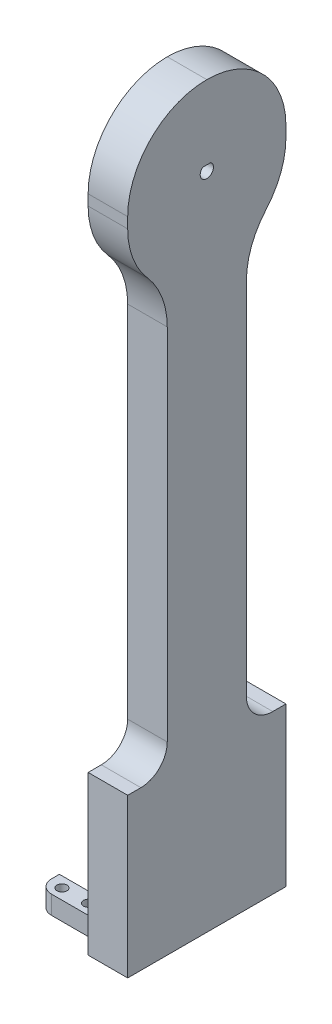
from build123d import *

# Parameters (mm, degrees)
SKETCH1_W           = 60
SKETCH1_H           = 60
BOSS_EXTRUDE1_DEPTH = 15
CUT_EXTRUDE1_DEPTH  = 15
SKETCH8_W           = 15
SKETCH8_H           = 30
BOSS_EXTRUDE2_DEPTH = 160
BOSS_EXTRUDE3_DEPTH = 60
SKETCH10_W          = 8
SKETCH10_H          = 7
BOSS_EXTRUDE4_DEPTH = 20
SKETCH12_R          = 1.9
CUT_EXTRUDE2_DEPTH  = 7
FILLET1_R           = 30
FILLET2_R           = 30
FILLET4_R           = 10
FILLET5_R           = 5


with BuildPart() as part:
    # Sketch1 → Boss-Extrude1 (new body)
    with BuildSketch(Plane(origin=(0, 0, 0), x_dir=(0, 0, -1), z_dir=(1, 0, 0))):
        Rectangle(SKETCH1_W, SKETCH1_H)
    extrude(amount=BOSS_EXTRUDE1_DEPTH)

    # Sketch2 → Cut-Extrude1 (cut)
    with BuildSketch(Plane(origin=(15, 0, 0), x_dir=(0, 0, -1), z_dir=(1, 0, 0))):
        with BuildLine():
            ThreePointArc((2.5, 0), (2.236067977, 1.118033989), (1.5, 2))
            Line((1.5, 2), (-1.5, 2))
            ThreePointArc((-1.5, 2), (-1.118033989, -2.236067977), (2.5, 0))
        make_face()
    extrude(amount=-CUT_EXTRUDE1_DEPTH, mode=Mode.SUBTRACT)

    # Sketch8 → Boss-Extrude2 (add)
    with BuildSketch(Plane.XZ.offset(30)):
        with Locations((7.5, 0)):
            Rectangle(SKETCH8_W, SKETCH8_H)
    extrude(amount=BOSS_EXTRUDE2_DEPTH)

    # Sketch9 → Boss-Extrude3 (add)
    with BuildSketch(Plane.XZ.offset(190)):
        Polygon((0, 0), (0, 30), (15, 30), (15, -30), (0, -30), align=None)
    extrude(amount=BOSS_EXTRUDE3_DEPTH)

    # Sketch10 → Boss-Extrude4 (add)
    with BuildSketch(Plane.ZY):
        with Locations((24.89, -241.5)):
            Rectangle(SKETCH10_W, SKETCH10_H)
        with Locations((-24.89, -241.5)):
            Rectangle(SKETCH10_W, SKETCH10_H)
    extrude(amount=BOSS_EXTRUDE4_DEPTH)

    # Sketch12 → Cut-Extrude2 (cut)
    with BuildSketch(Plane.XZ.offset(245)):
        with Locations(Location((-15.025, 24.89, 0), (0, 0, 270))):
            Circle(SKETCH12_R)
        with Locations(Location((-4.975, 24.89, 0), (0, 0, 270))):
            Circle(SKETCH12_R)
        with Locations(Location((-4.975, -24.89, 0), (0, 0, 270))):
            Circle(SKETCH12_R)
        with Locations(Location((-15.025, -24.89, 0), (0, 0, 270))):
            Circle(SKETCH12_R)
    extrude(amount=-CUT_EXTRUDE2_DEPTH, mode=Mode.SUBTRACT)

    # Fillet1
    # the kernel refuses this fillet: 30 mm, written as the material it takes off along each edge
    with BuildSketch(Plane(origin=(-64.951905284, -30, -30), x_dir=(0, 0, 1), z_dir=(1, 0, 0))) as fillet1_piece_1:
        with BuildLine():
            CenterArc((30, -25.980762114), FILLET1_R, 120, 60)
            Line((0, -25.980762114), (-0.6, -25.980762114))
            Line((-0.6, -25.980762114), (-0.6, 0))
            Line((-0.6, 0), (0, 0.6))
            ThreePointArc((0, 0.6), (7.5, 0.6), (14.7, 0.519615242))
            Line((14.7, 0.519615242), (15, 0))
        make_face()
    extrude(amount=144.903810568, mode=Mode.SUBTRACT)
    with BuildSketch(Plane(origin=(-75, 30, -30), x_dir=(0, 0, 1), z_dir=(1, 0, 0)), Plane(origin=(-75, 30, 30), x_dir=(0, -1, 0), z_dir=(1, 0, 0))) as fillet1_piece_2:
        with BuildLine():
            CenterArc((FILLET1_R, FILLET1_R), FILLET1_R, 180, 90)
            Line((0, FILLET1_R), (-FILLET1_R * 0.02, FILLET1_R))
            Line((-FILLET1_R * 0.02, FILLET1_R), (-FILLET1_R * 0.02, -FILLET1_R * 0.02))
            Line((-FILLET1_R * 0.02, -FILLET1_R * 0.02), (FILLET1_R, -FILLET1_R * 0.02))
            Line((FILLET1_R, -FILLET1_R * 0.02), (FILLET1_R, 0))
        make_face()
    extrude(amount=165, mode=Mode.SUBTRACT)
    with BuildSketch(Plane(origin=(-64.951905284, -30, 30), x_dir=(0, 0, -1), z_dir=(1, 0, 0))) as fillet1_piece_3:
        with BuildLine():
            CenterArc((30, 25.980762114), FILLET1_R, 180, 60)
            Line((0, 25.980762114), (-0.6, 25.980762114))
            Line((-0.6, 25.980762114), (-0.6, 0))
            Line((-0.6, 0), (0, -0.6))
            ThreePointArc((0, -0.6), (7.5, -0.6), (14.7, -0.519615242))
            Line((14.7, -0.519615242), (15, 0))
        make_face()
    extrude(amount=144.903810568, mode=Mode.SUBTRACT)

    # Fillet2
    fillet2_edges = [part.edges().sort_by_distance(p)[0] for p in [
        (7.5, -30, -15),
        (7.5, -30, 15),
    ]]
    fillet(fillet2_edges, radius=FILLET2_R)

    # Fillet4
    fillet4_edges = [part.edges().sort_by_distance(p)[0] for p in [
        (7.5, -190, -15),
        (7.5, -190, 15),
    ]]
    fillet(fillet4_edges, radius=FILLET4_R)

    # Fillet5
    fillet5_edges = [part.edges().sort_by_distance(p)[0] for p in [
        (-20, -241.5, 28.89),
        (-20, -241.5, -28.89),
    ]]
    fillet(fillet5_edges, radius=FILLET5_R)


solid = part.part
